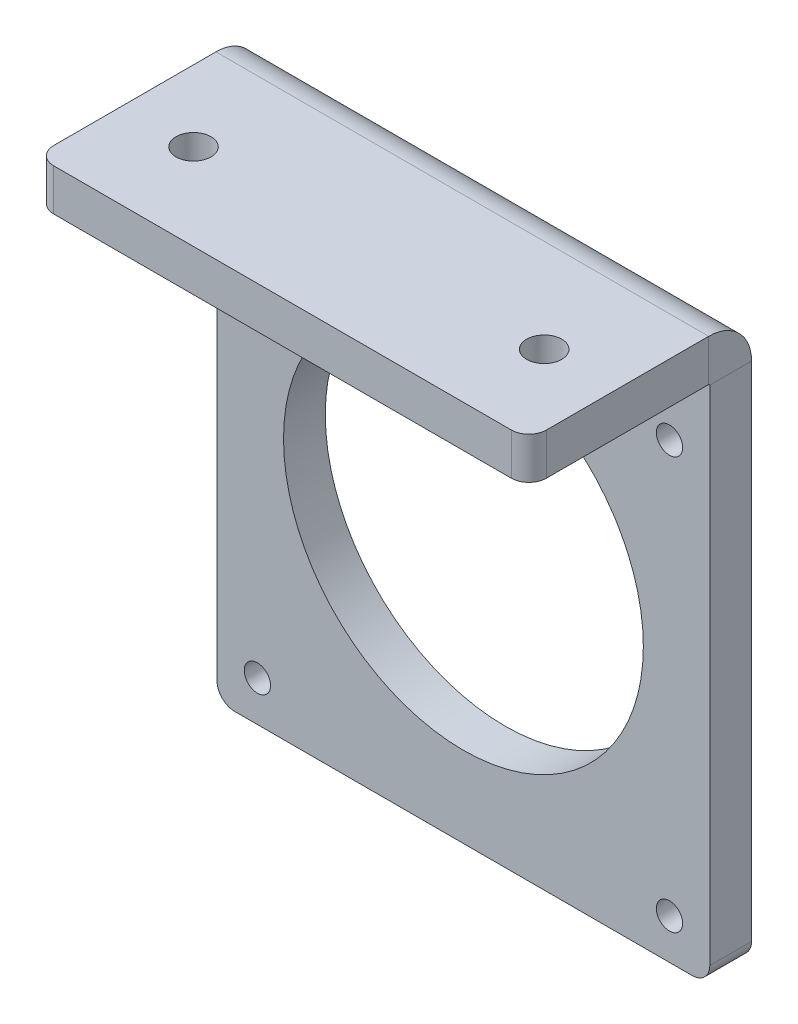
from build123d import *

# Parameters (mm, degrees)
SKETCH1_W                    = 56.2
SKETCH1_H                    = 59.45
SKETCH1_R                    = 20.52
SKETCH1_R_2                  = 1.5
BASE_FLANGE1_DEPTH           = 4.7625
EDGE_FLANGE1_STRIP_W         = 19.304
EDGE_FLANGE1_STRIP_H         = 4.7625
EDGE_FLANGE1_STRIP_CUT_DEPTH = 56.2
EDGE_FLANGE1_DEPTH           = 56.2
FILLET1_R                    = 2
CUT_EXTRUDE1_REACH           = 75.067
SKETCH11_R                   = 2


# Sheet-metal steps are written as plain solids
with BuildPart() as part:
    # Sketch1 → Base-Flange1 (new body)
    with BuildSketch(Plane.XY):
        Rectangle(SKETCH1_W, SKETCH1_H)
        Circle(SKETCH1_R, mode=Mode.SUBTRACT)
        with Locations((-23.5, 21.874999952)):
            Circle(SKETCH1_R_2, mode=Mode.SUBTRACT)
        with Locations((23.5, 21.874999952)):
            Circle(SKETCH1_R_2, mode=Mode.SUBTRACT)
        with Locations((-23.5, -25.125)):
            Circle(SKETCH1_R_2, mode=Mode.SUBTRACT)
        with Locations((23.5, -25.125)):
            Circle(SKETCH1_R_2, mode=Mode.SUBTRACT)
    extrude(amount=-BASE_FLANGE1_DEPTH)

    # Edge-Flange1 strip (across the edge) → Edge-Flange1 strip cut (cut)
    with BuildSketch(Plane(origin=(28.1, 29.725, 0), x_dir=(0, -1, 0), z_dir=(-1, 0, 0))):
        with Locations((-9.525, -2.38125)):
            Rectangle(EDGE_FLANGE1_STRIP_W, EDGE_FLANGE1_STRIP_H)
    extrude(amount=EDGE_FLANGE1_STRIP_CUT_DEPTH, mode=Mode.SUBTRACT)

    # Edge-Flange1 section (across the edge) → Edge-Flange1 (add)
    with BuildSketch(Plane(origin=(28.1, 29.725, 0), x_dir=(0, -1, 0), z_dir=(-1, 0, 0))):
        with BuildLine():
            Line((-4.7625, 0.127), (-4.7625, 20.6375))
            Line((-4.7625, 20.6375), (0, 20.6375))
            Line((0, 20.6375), (0, 0.127))
            ThreePointArc((0, 0.127), (0.037197439, 0.037197439), (0.127, 0))
            Line((0.127, 0), (0.127, -4.7625))
            ThreePointArc((0.127, -4.7625), (-3.330398607, -3.330398607), (-4.7625, 0.127))
        make_face()
    extrude(amount=EDGE_FLANGE1_DEPTH)

    # Fillet1
    fillet1_edges = [part.edges().sort_by_distance(p)[0] for p in [
        (28.1, 32.10625, 20.6375),
        (-28.1, 32.10625, 20.6375),
        (28.1, -29.725, -2.38125),
        (-28.1, -29.725, -2.38125),
    ]]
    fillet(fillet1_edges, radius=FILLET1_R)

    # Sketch11 → Cut-Extrude1 (cut, up to next)
    with BuildSketch(Plane(origin=(0, 34.4875, 0), x_dir=(1, 0, 0), z_dir=(0, 1, 0)), mode=Mode.PRIVATE) as cut_extrude1_sk1:
        with Locations(Location((-20, -10.7875, 0), (0, 0, 270))):
            Circle(SKETCH11_R)
    cut_extrude1_tool1 = extrude(cut_extrude1_sk1.sketch, amount=-CUT_EXTRUDE1_REACH, mode=Mode.PRIVATE) & part.part
    # Sketch11 → Cut-Extrude1 (cut, up to next)
    with BuildSketch(Plane(origin=(0, 34.4875, 0), x_dir=(1, 0, 0), z_dir=(0, 1, 0)), mode=Mode.PRIVATE) as cut_extrude1_sk2:
        with Locations(Location((20, -10.7875, 0), (0, 0, 270))):
            Circle(SKETCH11_R)
    cut_extrude1_tool2 = extrude(cut_extrude1_sk2.sketch, amount=-CUT_EXTRUDE1_REACH, mode=Mode.PRIVATE) & part.part
    add(cut_extrude1_tool1.solids().sort_by_distance((-20, 34.4875, 10.7875))[0], mode=Mode.SUBTRACT)
    add(cut_extrude1_tool2.solids().sort_by_distance((20, 34.4875, 10.7875))[0], mode=Mode.SUBTRACT)


solid = part.part
